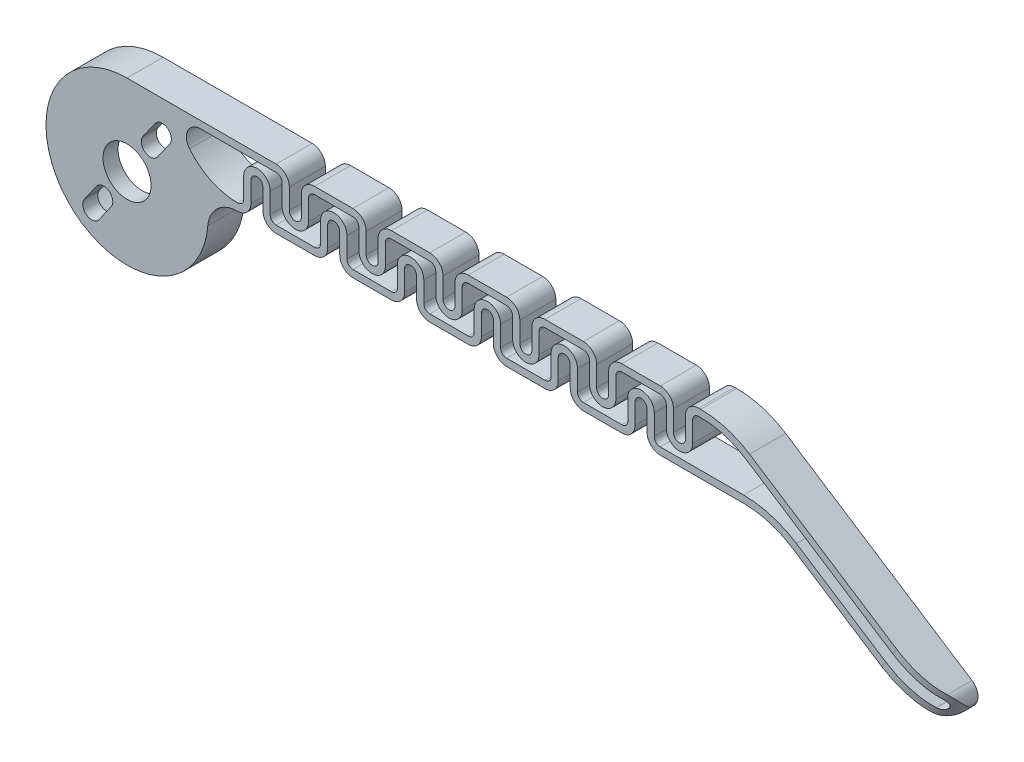
from build123d import *

# Parameters (mm, degrees)
ESQUISSE1_R                = 4
BOSS_EXTRU_1_DEPTH         = 3
ENL_V_START                = -2.5
ESQUISSE5_R                = 12.25
ENL_V_MAT_EXTRU_3_DEPTH    = 135.964482207
ENL_V_MAT_EXTRU_4_DEPTH    = 138.464482207
CONG_4_R                   = 5
CONG_3_R                   = 15
CONG_5_SIZE                = 5
CONG_5_SIZE_2              = 10
ENL_V_MAT_EXTRU_5_DEPTH    = 138.464482321
R_P_TITION_LIN_AIRE1_COUNT = 6
R_P_TITION_LIN_AIRE1_PITCH = 12.8
ENL_V_MAT_EXTRU_6_DEPTH    = 138.464482321
CONG_6_START               = -4
CONG_6_DEPTH               = 5.129707398


with BuildPart() as part:
    # Esquisse1 → Boss.-Extru.1 (new, symmetric)
    with BuildSketch(Plane.XY):
        with BuildLine():
            Line((0, 13.5), (100, 13.5))
            Line((100, 13.5), (136.618021756, -10.223313142))
            Line((136.618021756, -10.223313142), (134.171261372, -14))
            Line((134.171261372, -14), (107.159208844, 3.5))
            Line((107.159208844, 3.5), (13.03840481, 3.5))
            ThreePointArc((13.03840481, 3.5), (-8.215838363, -10.712142643), (0, 13.5))
        make_face()
        Circle(ESQUISSE1_R, mode=Mode.SUBTRACT)
    extrude(amount=BOSS_EXTRU_1_DEPTH, both=True)

    # Esquisse5 → Enlèv. mat.-Extru.3 (cut, through all)
    with BuildSketch(Plane.XY.offset(3).offset(ENL_V_START)):
        Circle(ESQUISSE5_R)
    extrude(amount=-ENL_V_MAT_EXTRU_3_DEPTH, mode=Mode.SUBTRACT)

    # Esquisse6 → Enlèv. mat.-Extru.4 (cut, through all)
    with BuildSketch(Plane.XY.offset(3)):
        with BuildLine():
            Line((7.107886539, 7.535943799), (5.100369012, 4.668911644))
            ThreePointArc((5.100369012, 4.668911644), (3.011276291, 4.300548233), (2.642912879, 6.389640953))
            Line((2.642912879, 6.389640953), (4.650430406, 9.256673108))
            ThreePointArc((4.650430406, 9.256673108), (6.739523127, 9.62503652), (7.107886539, 7.535943799))
        make_face()
        with BuildLine():
            Line((-2.642912879, -6.389640953), (-4.650430406, -9.256673108))
            ThreePointArc((-4.650430406, -9.256673108), (-6.739523127, -9.62503652), (-7.107886539, -7.535943799))
            Line((-7.107886539, -7.535943799), (-5.100369012, -4.668911644))
            ThreePointArc((-5.100369012, -4.668911644), (-3.011276291, -4.300548233), (-2.642912879, -6.389640953))
        make_face()
    extrude(amount=-ENL_V_MAT_EXTRU_4_DEPTH, mode=Mode.SUBTRACT)

    # Congé4
    cong_4_edges = [part.edges().sort_by_distance(p)[0] for p in [
        (13.03840481, 3.5, 0),
    ]]
    fillet(cong_4_edges, radius=CONG_4_R)

    # Congé3
    cong_3_edges = [part.edges().sort_by_distance(p)[0] for p in [
        (107.159208844, 3.5, 0),
        (100, 13.5, 0),
    ]]
    fillet(cong_3_edges, radius=CONG_3_R)

    # Congé5
    # a fillet whose section is not a circle: 10, 5 mm, written as the material it takes off along each edge
    with BuildSketch(Plane(origin=(150.211135, 10.758280514, 3), x_dir=(0, 0, -1), z_dir=(-0.5437245297751158, -0.8392637462209537, 0))) as cong_5_piece_1:
        with BuildLine():
            Bezier((CONG_5_SIZE, 0), (0, 0), (0, -CONG_5_SIZE_2), weights=[1, 0.707106781, 1])
            Line((0, -CONG_5_SIZE_2), (0, 0))
            Line((0, 0), (CONG_5_SIZE, 0))
        make_face()
    extrude(amount=54.5, mode=Mode.SUBTRACT)

    # Esquisse8 → Enlèv. mat.-Extru.5 (cut, symmetric)
    with BuildSketch(Plane(origin=(0, 0, -3), x_dir=(-1, 0, 0), z_dir=(0, 0, -1))):
        with BuildLine():
            Line((-22.639088915, 9.1), (-22.639088915, 5.7))
            ThreePointArc((-22.639088915, 5.7), (-23.283453996, 4.144365081), (-24.839088915, 3.5))
            Line((-24.839088915, 3.5), (-18.439088915, 3.5))
            ThreePointArc((-18.439088915, 3.5), (-19.994723833, 4.144365081), (-20.639088915, 5.7))
            Line((-20.639088915, 5.7), (-20.639088915, 9.1))
            ThreePointArc((-20.639088915, 9.1), (-21.639088915, 10.1), (-22.639088915, 9.1))
        make_face()
        with BuildLine():
            Line((-24.839088915, 12.3), (-18.439088915, 12.3))
            Line((-18.439088915, 12.3), (-18.439088915, 4.7))
            ThreePointArc((-18.439088915, 4.7), (-19.146195696, 4.992893219), (-19.439088915, 5.7))
            Line((-19.439088915, 5.7), (-19.439088915, 9.1))
            ThreePointArc((-19.439088915, 9.1), (-21.639088915, 11.3), (-23.839088915, 9.1))
            Line((-23.839088915, 9.1), (-23.839088915, 5.7))
            ThreePointArc((-23.839088915, 5.7), (-24.131982133, 4.992893219), (-24.839088915, 4.7))
            Line((-24.839088915, 4.7), (-31.239088915, 4.7))
            Line((-31.239088915, 4.7), (-31.239088915, 12.3))
            ThreePointArc((-31.239088915, 12.3), (-30.531982133, 12.007106781), (-30.239088915, 11.3))
            Line((-30.239088915, 11.3), (-30.239088915, 7.9))
            ThreePointArc((-30.239088915, 7.9), (-28.039088915, 5.7), (-25.839088915, 7.9))
            Line((-25.839088915, 7.9), (-25.839088915, 11.3))
            ThreePointArc((-25.839088915, 11.3), (-25.546195696, 12.007106781), (-24.839088915, 12.3))
        make_face()
        with BuildLine():
            Line((-31.239088915, 13.5), (-24.839088915, 13.5))
            ThreePointArc((-24.839088915, 13.5), (-26.394723833, 12.855634919), (-27.039088915, 11.3))
            Line((-27.039088915, 11.3), (-27.039088915, 7.9))
            ThreePointArc((-27.039088915, 7.9), (-28.039088915, 6.9), (-29.039088915, 7.9))
            Line((-29.039088915, 7.9), (-29.039088915, 11.3))
            ThreePointArc((-29.039088915, 11.3), (-29.683453996, 12.855634919), (-31.239088915, 13.5))
        make_face()
    enl_v_mat_extru_5 = extrude(amount=ENL_V_MAT_EXTRU_5_DEPTH, both=True, mode=Mode.SUBTRACT)

    # Répétition linéaire1: Enlèv. mat.-Extru.5 ×6
    with Locations(*[(i * R_P_TITION_LIN_AIRE1_PITCH, 0, 0) for i in range(1, R_P_TITION_LIN_AIRE1_COUNT)]):
        add(enl_v_mat_extru_5, mode=Mode.SUBTRACT)

    # Esquisse9 → Enlèv. mat.-Extru.6 (cut, through all)
    with BuildSketch(Plane(origin=(0, 0, -3), x_dir=(-1, 0, 0), z_dir=(0, 0, -1))):
        with BuildLine():
            Line((-18.439088915, 12.3), (-18.439088915, 4.7))
            ThreePointArc((-18.439088915, 4.7), (-14.000364812, 5.699739611), (-10.418846039, 8.505888972))
            ThreePointArc((-10.418846039, 8.505888972), (-10.119472718, 10.972193932), (-12.219285944, 12.3))
            Line((-12.219285944, 12.3), (-18.439088915, 12.3))
        make_face()
        with BuildLine():
            Line((-134.414711295, -11.417223948), (-134.360338842, -11.501150323))
            ThreePointArc((-134.360338842, -11.501150323), (-133.730052879, -11.935346181), (-132.977350566, -11.796689539))
            Line((-132.977350566, -11.796689539), (-111.533234963, 2.096072689))
            ThreePointArc((-111.533234963, 2.096072689), (-107.317479776, 4.035385054), (-102.72489758, 4.7))
            Line((-102.72489758, 4.7), (-95.239088915, 4.7))
            Line((-95.239088915, 4.7), (-95.239088915, 12.296134696))
            ThreePointArc((-95.239088915, 12.296134696), (-99.32100303, 11.779217393), (-103.069087247, 10.081839698))
            Line((-103.069087247, 10.081839698), (-134.119172078, -10.034235672))
            ThreePointArc((-134.119172078, -10.034235672), (-134.553367937, -10.664521634), (-134.414711295, -11.417223948))
        make_face()
    extrude(amount=-ENL_V_MAT_EXTRU_6_DEPTH, mode=Mode.SUBTRACT)

    # Congé6: read off the stored shape, not the designer's step
    # Congé6 outline → Congé6 (cut)
    with BuildSketch(Plane.XY.offset(CONG_6_START)):
        with BuildLine():
            Line((136.618021756, -10.223313142), (134.771641514, -9.027119176))
            ThreePointArc((134.771641514, -9.027119176), (135.726872403, -10.413748293), (135.42182779, -12.069693384))
            Line((135.42182779, -12.069693384), (136.618021756, -10.223313142))
        make_face()
        with BuildLine():
            Line((134.171261372, -14), (135.367455337, -12.153619758))
            ThreePointArc((135.367455337, -12.153619758), (133.98082622, -13.108850647), (132.32488113, -12.803806034))
            Line((132.32488113, -12.803806034), (134.171261372, -14))
        make_face()
    extrude(amount=CONG_6_DEPTH, mode=Mode.SUBTRACT)


solid = part.part
